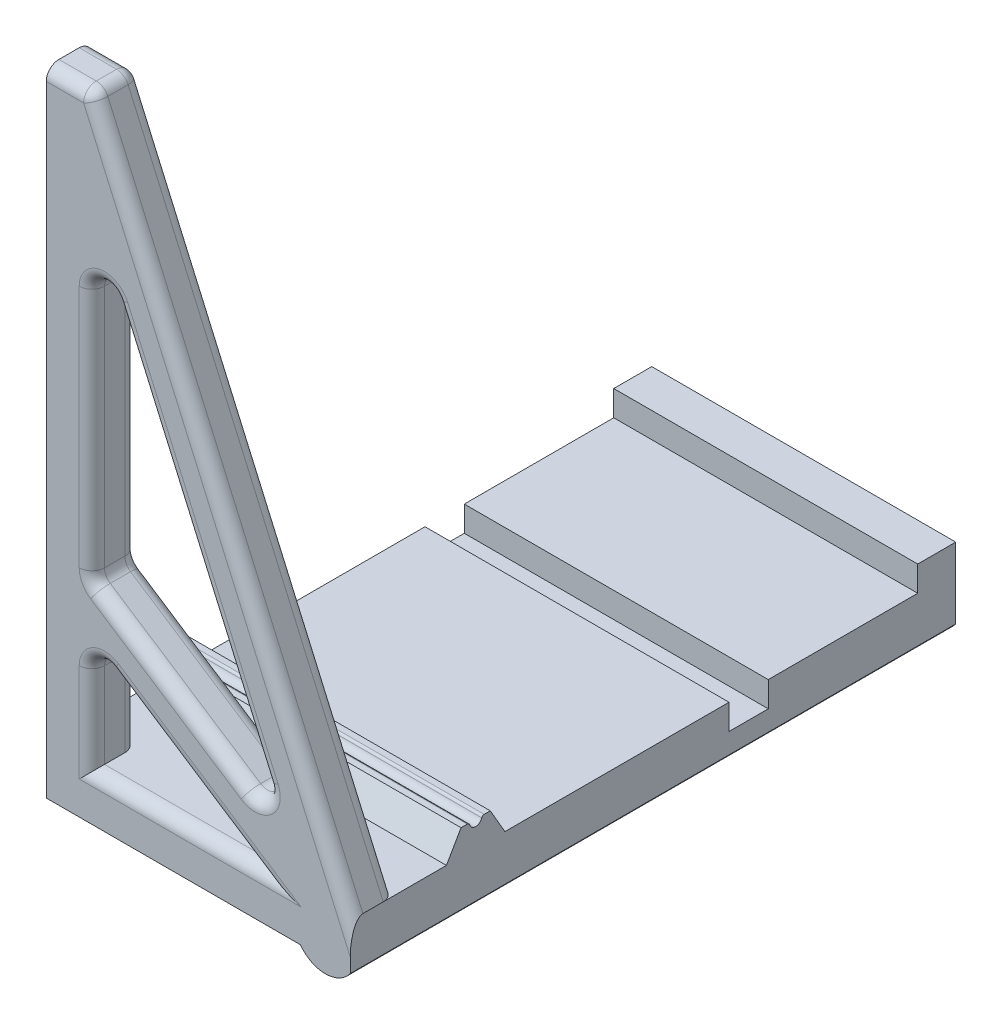
from build123d import *

# Parameters (mm, degrees)
EXTRUDE_1_DEPTH     = 120
SKETCH_2_W          = 15.5
SKETCH_2_H          = 10
CUT_EXTRUDE_1_DEPTH = 324.916484435
CUT_EXTRUDE_2_DEPTH = 40
CUT_EXTRUDE_3_DEPTH = 40
FILLET_16_R         = 5
EXTRUDE_2_DEPTH     = 239
EXTRUDE_3_DEPTH     = 18
FILLET_17_R         = 5
EXTRUDE_4_DEPTH     = 120
SKETCH_11_R         = 2.5
EXTRUDE_5_DEPTH     = 110
SKETCH_12_R         = 2.5
CUT_EXTRUDE_4_DEPTH = 324.916484528
FILLET_19_R         = 1


with BuildPart() as part:
    # 草圖1 → 填料-伸長1 (new body)
    with BuildSketch(Plane(origin=(0, 0, 0), x_dir=(0, 0, -1), z_dir=(1, 0, 0))):
        Polygon((-179.666666667, 241.333333333), (-179.666666667, -8.666666667), (59.333333333, -8.666666667), (59.333333333, 9.333333333), (59.333333333, 19.333333333), (44.333333333, 19.333333333), (44.333333333, 9.333333333), (-161.666666667, 9.333333333), (-161.666666667, 241.333333333), align=None)
    extrude(amount=EXTRUDE_1_DEPTH)

    # 草圖2 → 除料-伸長1 (cut, through all)
    with BuildSketch(Plane(origin=(120, 0, 0), x_dir=(0, 0, -1), z_dir=(1, 0, 0))):
        with Locations((-22.416666667, 4.333333333)):
            Rectangle(SKETCH_2_W, SKETCH_2_H)
    extrude(amount=-CUT_EXTRUDE_1_DEPTH, mode=Mode.SUBTRACT)

    # 草圖4 → 除料-伸長2 (cut)
    with BuildSketch(Plane.XY.offset(179.666666667)):
        Polygon((120, 241.333333333), (18, 241.333333333), (120, 9.333333333), align=None)
    extrude(amount=-CUT_EXTRUDE_2_DEPTH, mode=Mode.SUBTRACT)

    # 草圖5 → 除料-伸長3 (cut)
    with BuildSketch(Plane.XY.offset(179.666666667)):
        Polygon((100.337138528, 9.333333333), (18, 196.609962141), (18, 9.333333333), align=None)
    extrude(amount=-CUT_EXTRUDE_3_DEPTH, mode=Mode.SUBTRACT)

    # 圓角16
    # the kernel refuses this fillet: 5 mm, written as the material it takes off along each edge
    with BuildSketch(Plane(origin=(14.736369898, 236.333333333, 166.666666667), x_dir=(0, 1, 0), z_dir=(0, 0, -1))) as fillet_16_piece_1_section:
        Polygon((0, 0), (FILLET_16_R, 0), (FILLET_16_R, FILLET_16_R * 0.652726020499), (FILLET_16_R * 0.402474131984, FILLET_16_R * 0.915431359023), align=None)
    fillet_16_piece_1 = extrude(amount=FILLET_16_R, mode=Mode.PRIVATE)
    fillet_16_piece_1 = fillet_16_piece_1 - Plane(origin=(14.736369898, 236.333333333, 166.666666667), x_dir=(-0.5465921093537591, -0.8373989885306815, 0), z_dir=(0, 0, -1)) * Sphere(FILLET_16_R, mode=Mode.PRIVATE)
    add(fillet_16_piece_1, mode=Mode.SUBTRACT)
    with BuildSketch(Plane(origin=(14.736369898, 236.333333333, 174.666666667), x_dir=(0, 1, 0), z_dir=(0, 0, 1))) as fillet_16_piece_2_section:
        Polygon((0, 0), (FILLET_16_R, 0), (FILLET_16_R, -FILLET_16_R * 0.652726020499), (FILLET_16_R * 0.402474131984, -FILLET_16_R * 0.915431359023), align=None)
    fillet_16_piece_2 = extrude(amount=FILLET_16_R, mode=Mode.PRIVATE)
    fillet_16_piece_2 = fillet_16_piece_2 - Plane(origin=(14.736369898, 236.333333333, 174.666666667), x_dir=(-0.5465921093537591, -0.8373989885306815, 0), z_dir=(0, 0, 1)) * Sphere(FILLET_16_R, mode=Mode.PRIVATE)
    add(fillet_16_piece_2, mode=Mode.SUBTRACT)
    with BuildSketch(Plane(origin=(-12.5, 241.333333333, 161.666666667), x_dir=(0, 0, 1), z_dir=(1, 0, 0)), Plane(origin=(-12.5, 241.333333333, 179.666666667), x_dir=(0, -1, 0), z_dir=(1, 0, 0))) as fillet_16_piece_3:
        with BuildLine():
            CenterArc((FILLET_16_R, FILLET_16_R), FILLET_16_R, 180, 90)
            Line((0, FILLET_16_R), (0, 0))
            Line((0, 0), (FILLET_16_R, 0))
        make_face()
    extrude(amount=27.236369898, mode=Mode.SUBTRACT)
    with BuildSketch(Plane(origin=(18, 241.333333333, 174.666666667), x_dir=(-1, 0, 0), z_dir=(0, 0, -1))) as fillet_16_piece_4:
        with BuildLine():
            CenterArc((FILLET_16_R * 0.652726020499, -FILLET_16_R), FILLET_16_R, 90, 66.267060196)
            Line((-FILLET_16_R * 0.262705338524, -FILLET_16_R * 0.597525868016), (0, 0))
            Line((0, 0), (FILLET_16_R * 0.652726020499, 0))
        make_face()
    extrude(amount=8, mode=Mode.SUBTRACT)
    with BuildSketch(Plane(origin=(19.313526693, 238.345703993, 161.666666667), x_dir=(0, 0, 1), z_dir=(0.40247413198441667, -0.9154313590233789, 0))) as fillet_16_piece_5_section:
        with BuildLine():
            CenterArc((FILLET_16_R, FILLET_16_R), FILLET_16_R, 180, 90)
            Line((0, FILLET_16_R), (0, 0))
            Line((0, 0), (FILLET_16_R, 0))
        make_face()
    fillet_16_piece_5 = extrude(amount=262.668806653, mode=Mode.PRIVATE)
    fillet_16_piece_5 = split(fillet_16_piece_5, bisect_by=Plane(origin=(68.522420019, 9.333333333, 162.799850977), z_dir=(0, 1, 0)), keep=Keep.TOP, mode=Mode.PRIVATE)
    add(fillet_16_piece_5, mode=Mode.SUBTRACT)
    with BuildSketch(Plane(origin=(19.313526693, 238.345703993, 179.666666667), x_dir=(-0.9154313590233789, -0.40247413198441667, 5.6843418860808026e-15), z_dir=(0.40247413198441667, -0.9154313590233789, 0))) as fillet_16_piece_6:
        with BuildLine():
            CenterArc((FILLET_16_R, FILLET_16_R), FILLET_16_R, 180, 90)
            Line((0, FILLET_16_R), (0, 0))
            Line((0, 0), (FILLET_16_R, 0))
        make_face()
    extrude(amount=262.668806653, mode=Mode.SUBTRACT)

    # 草圖8 → 填料-伸長2 (add)
    with BuildSketch(Plane.XY.offset(179.666666667)):
        with BuildLine():
            ThreePointArc((110.17, -13.666666712), (115.684274668, -12.344840676), (120, -8.666666667))
            Line((120, -8.666666667), (110.17, -8.666666667))
            Line((110.17, -8.666666667), (110.17, -13.666666667))
        make_face()
        with BuildLine():
            Line((110.17, -13.666666667), (110.17, -8.666666667))
            Line((110.17, -8.666666667), (100.34, -8.666666667))
            ThreePointArc((100.34, -8.666666667), (104.655725332, -12.344840676), (110.17, -13.666666712))
        make_face()
        with BuildLine():
            ThreePointArc((110.17, -13.666666712), (115.684274668, -12.344840676), (120, -8.666666667))
            Line((120, -8.666666667), (110.17, -8.666666667))
            Line((110.17, -8.666666667), (110.17, -13.666666667))
        make_face()
        with BuildLine():
            Line((110.17, -13.666666667), (110.17, -8.666666667))
            Line((110.17, -8.666666667), (100.34, -8.666666667))
            ThreePointArc((100.34, -8.666666667), (104.655725332, -12.344840676), (110.17, -13.666666712))
        make_face()
    extrude(amount=-EXTRUDE_2_DEPTH)

    # 草圖9 → 填料-伸長3 (add)
    with BuildSketch(Plane.XY.offset(179.666666667)):
        Polygon((18, 63.079938443), (100.337138528, 9.333333333), (93.709875708, 24.407107589), (22.919522331, 70.616403134), (18, 73.827683351), align=None)
        Polygon((18, 52.332193536), (83.872125352, 9.333333333), (100.337138528, 9.333333333), (18, 63.079938443), align=None)
        Polygon((100.337138528, 9.333333333), (83.872125352, 9.333333333), (95.417616197, 1.796868643), align=None)
        Polygon((93.711170014, 24.406262715), (100.337138528, 9.333333333), (105.256660859, 16.869798024), align=None)
        Polygon((10.463535309, 67.999460774), (18, 63.079938443), (18, 73.827683351), (15.38305764, 75.535925465), align=None)
        Polygon((13.080477669, 55.543473753), (18, 52.332193536), (18, 63.079938443), align=None)
    extrude(amount=-EXTRUDE_3_DEPTH)

    # 圓角17
    fillet_17_edges = [part.edges().sort_by_distance(p)[0] for p in [
        (93.709875708, 24.407107589, 170.666666667),
        (18, 30.832763435, 179.666666667),
        (18, 30.832763435, 161.666666667),
        (18, 52.332193536, 170.666666667),
        (50.936062676, 30.832763435, 161.666666667),
        (50.936062676, 30.832763435, 179.666666667),
        (18, 73.827683351, 170.666666667),
        (55.854937854, 49.11739547, 179.666666667),
        (55.854937854, 49.11739547, 161.666666667),
        (55.854937854, 110.508534865, 161.666666667),
        (18, 135.218822746, 161.666666667),
        (18, 196.609962141, 170.666666667),
        (55.854937854, 110.508534865, 179.666666667),
        (18, 135.218822746, 179.666666667),
        (50.936062676, 9.333333333, 179.666666667),
    ]]
    fillet(fillet_17_edges, radius=FILLET_17_R)

    # 草圖10 → 填料-伸長4 (add)
    with BuildSketch(Plane(origin=(120, 0, 0), x_dir=(0, 0, -1), z_dir=(1, 0, 0))):
        Polygon((-118.619661283, 9.333333333), (-124.393163975, 19.333333333), (-135.940169359, 19.333333333), (-141.71367205, 9.333333333), (-135.940169359, -0.666666667), (-124.393163975, -0.666666667), align=None)
    extrude(amount=-EXTRUDE_4_DEPTH)

    # 草圖11 → 填料-伸長5 (add)
    with BuildSketch(Plane.ZY):
        with Locations((140.666666667, -8.666666667)):
            Circle(SKETCH_11_R)
        with Locations((90.666666667, -8.666666667)):
            Circle(SKETCH_11_R)
        with Locations((40.666666667, -8.666666667)):
            Circle(SKETCH_11_R)
        with Locations((-9.333333333, -8.666666667)):
            Circle(SKETCH_11_R)
    extrude(amount=-EXTRUDE_5_DEPTH)

    # 草圖12 → 除料-伸長4 (cut, through all)
    with BuildSketch(Plane(origin=(120, 0, 0), x_dir=(0, 0, -1), z_dir=(1, 0, 0))):
        with Locations((-130.168163975, 19.333333333)):
            Circle(SKETCH_12_R)
    extrude(amount=-CUT_EXTRUDE_4_DEPTH, mode=Mode.SUBTRACT)

    # 圓角19
    fillet_19_edges = [part.edges().sort_by_distance(p)[0] for p in [
        (60, 19.333333333, 127.668163975),
        (60, 19.333333333, 132.668163975),
    ]]
    fillet(fillet_19_edges, radius=FILLET_19_R)


solid = part.part
